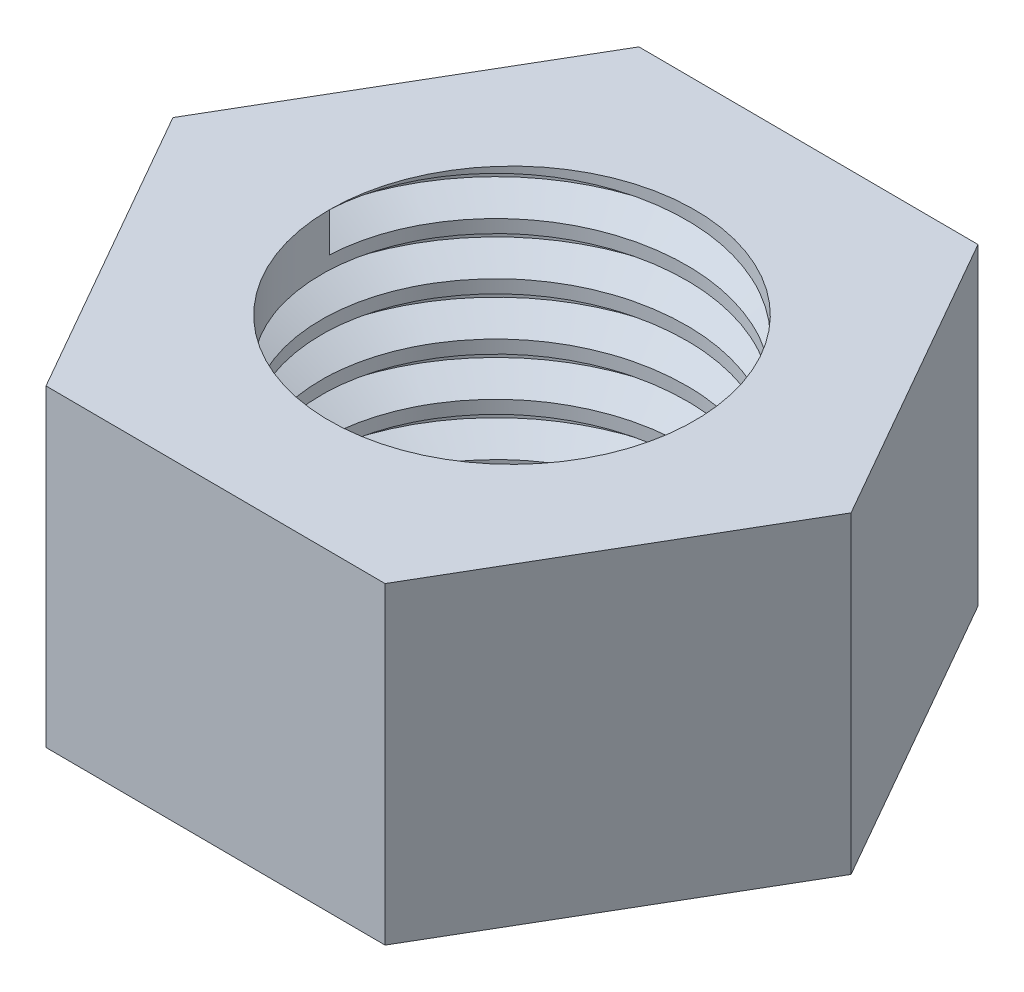
from build123d import *

# Parameters (mm, degrees)
SKETCH2_R           = 3.5
BOSS_EXTRUDE1_DEPTH = 6
THREAD1_PITCH       = 1


with BuildPart() as part:
    # Sketch2 → Boss-Extrude1 (new body)
    with BuildSketch(Plane(origin=(0, 0, 0), x_dir=(1, 0, 0), z_dir=(0, 1, 0))):
        Polygon((3.29122551, 5.638020076), (-3.237055858, 5.669294939), (-6.528281368, 0.031274863), (-3.29122551, -5.638020076), (3.237055858, -5.669294939), (6.528281368, -0.031274863), align=None)
        with Locations(Location((0, 0, 0), (0, 0, 270))):
            Circle(SKETCH2_R, mode=Mode.SUBTRACT)
    extrude(amount=BOSS_EXTRUDE1_DEPTH)

    # Thread1: the profile of Thread Profile1 profile screwed along a right-hand helix of 6 turns, 8 arcs to a turn; built about Z, then put on its axis
    thread1_z = Axis((0, 0, 0), (0, 0, 1))
    thread1_corners = [(3.4997, 0, -0.000173205), (4.041265875, 0, 0.312499999), (4.041265875, 0, 0.437499999), (3.4997, 0, 0.750173202)]
    with BuildLine(mode=Mode.PRIVATE) as thread1_profile:
        Line(thread1_corners[0], thread1_corners[1])
        Line(thread1_corners[1], thread1_corners[2])
        Line(thread1_corners[2], thread1_corners[3])
        Line(thread1_corners[3], thread1_corners[0])
    thread1_cap = Face(thread1_profile.wire())
    thread1_turn_angles = [0, 22.5, 45, 67.5, 90, 112.5, 135, 157.5, 180, 202.5, 225, 247.5, 270, 292.5, 315, 337.5, 360]
    thread1_turn_weights = [1, 0.9238795325112867, 1, 0.9238795325112867, 1, 0.9238795325112867, 1, 0.9238795325112867, 1, 0.9238795325112867, 1, 0.9238795325112867, 1, 0.9238795325112867, 1, 0.9238795325112867, 1]
    thread1_turn_rails = [Edge.make_bspline([Vector(p[0], p[1], 0).rotate(thread1_z, thread1_turn_angles[k]) / thread1_turn_weights[k] + Vector(0, 0, p[2] + THREAD1_PITCH * thread1_turn_angles[k] / 360) for k in range(17)], [0, 0, 0, 1, 1, 2, 2, 3, 3, 4, 4, 5, 5, 6, 6, 7, 7, 8, 8, 8], 2, thread1_turn_weights) for p in thread1_corners]
    thread1_turn_sides = [Face.make_surface_from_curves(thread1_turn_rails[p[0]], thread1_turn_rails[p[1]]) for p in [(0, 1), (1, 2), (2, 3), (3, 0)]]
    thread1 = Plane(origin=(0, 6, 0), x_dir=(-1, 0, 0), z_dir=(0, -1, 0)) * Solid(Shell([*[p.moved(Location((0, 0, THREAD1_PITCH * i))) for i in range(6) for p in thread1_turn_sides], thread1_cap, thread1_cap.rotate(thread1_z, 2160).moved(Location((0, 0, THREAD1_PITCH * 2160 / 360)))]))
    add(thread1, mode=Mode.SUBTRACT)


solid = part.part
